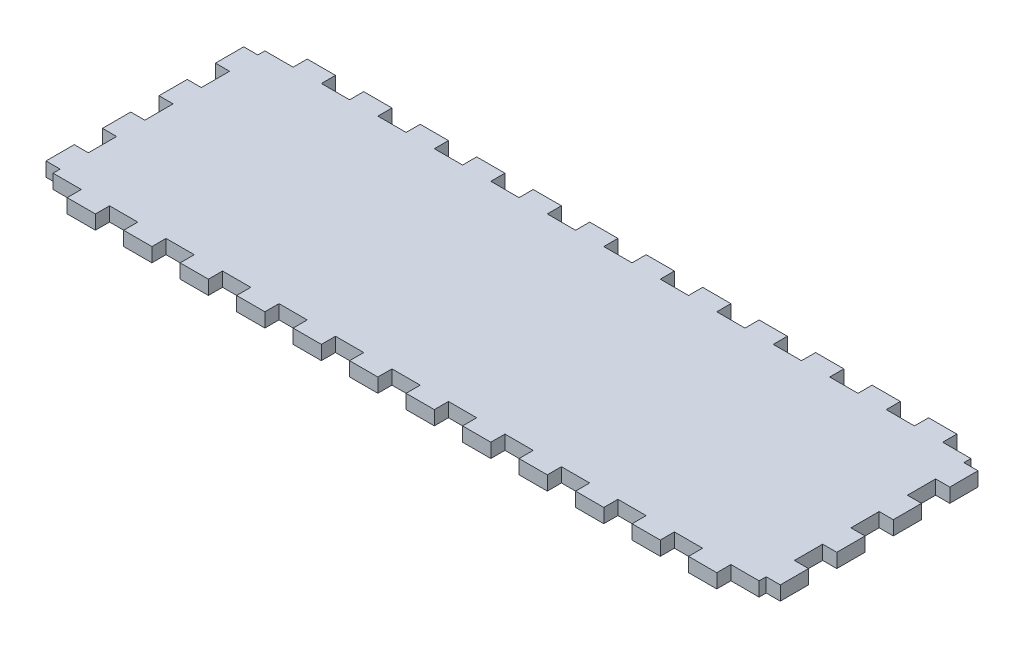
from build123d import *

# Parameters (mm, degrees)
SKETCH1_W                = 150
SKETCH1_H                = 45
BOSS_EXTRUDE1_DEPTH      = 3
SKETCH2_W                = 6
SKETCH2_H                = 3
BOSS_EXTRUDE2_DEPTH      = 3
LPATTERN1_COUNT          = 6
LPATTERN1_PITCH          = 12
LPATTERN1_COL_COUNT      = 7
LPATTERN1_COL_PITCH      = 12
SKETCH3_W                = 6
SKETCH3_H                = 3
BOSS_EXTRUDE3_DEPTH      = 3
LPATTERN2_COUNT          = 2
LPATTERN2_PITCH          = 12
LPATTERN2_COUNT_DIR2     = 3
LPATTERN2_PITCH_DIR2     = 12
MIRROR1_COPY_1_SKETCH_W  = 6
MIRROR1_COPY_1_SKETCH_H  = 3
MIRROR1_COPY_1_DEPTH     = 3
MIRROR1_COPY_2_SKETCH_W  = 6
MIRROR1_COPY_2_SKETCH_H  = 3
MIRROR1_COPY_2_DEPTH     = 3
MIRROR1_COPY_3_SKETCH_W  = 6
MIRROR1_COPY_3_SKETCH_H  = 3
MIRROR1_COPY_3_DEPTH     = 3
MIRROR1_COPY_4_SKETCH_W  = 6
MIRROR1_COPY_4_SKETCH_H  = 3
MIRROR1_COPY_4_DEPTH     = 3
MIRROR1_COPY_5_SKETCH_W  = 6
MIRROR1_COPY_5_SKETCH_H  = 3
MIRROR1_COPY_5_DEPTH     = 3
MIRROR1_COPY_6_SKETCH_W  = 6
MIRROR1_COPY_6_SKETCH_H  = 3
MIRROR1_COPY_6_DEPTH     = 3
MIRROR1_COPY_7_SKETCH_W  = 6
MIRROR1_COPY_7_SKETCH_H  = 3
MIRROR1_COPY_7_DEPTH     = 3
MIRROR1_COPY_8_SKETCH_W  = 6
MIRROR1_COPY_8_SKETCH_H  = 3
MIRROR1_COPY_8_DEPTH     = 3
MIRROR1_COPY_9_SKETCH_W  = 6
MIRROR1_COPY_9_SKETCH_H  = 3
MIRROR1_COPY_9_DEPTH     = 3
MIRROR1_COPY_10_SKETCH_W = 6
MIRROR1_COPY_10_SKETCH_H = 3
MIRROR1_COPY_10_DEPTH    = 3
MIRROR1_COPY_11_SKETCH_W = 6
MIRROR1_COPY_11_SKETCH_H = 3
MIRROR1_COPY_11_DEPTH    = 3
MIRROR1_COPY_12_SKETCH_W = 6
MIRROR1_COPY_12_SKETCH_H = 3
MIRROR1_COPY_12_DEPTH    = 3
MIRROR2_COPY_1_SKETCH_W  = 6
MIRROR2_COPY_1_SKETCH_H  = 3
MIRROR2_COPY_1_DEPTH     = 3
MIRROR2_COPY_2_SKETCH_W  = 6
MIRROR2_COPY_2_SKETCH_H  = 3
MIRROR2_COPY_2_DEPTH     = 3
MIRROR2_COPY_3_SKETCH_W  = 6
MIRROR2_COPY_3_SKETCH_H  = 3
MIRROR2_COPY_3_DEPTH     = 3
MIRROR2_COPY_4_SKETCH_W  = 6
MIRROR2_COPY_4_SKETCH_H  = 3
MIRROR2_COPY_4_DEPTH     = 3
MIRROR2_COPY_5_SKETCH_W  = 6
MIRROR2_COPY_5_SKETCH_H  = 3
MIRROR2_COPY_5_DEPTH     = 3
MIRROR2_COPY_6_SKETCH_W  = 6
MIRROR2_COPY_6_SKETCH_H  = 3
MIRROR2_COPY_6_DEPTH     = 3


with BuildPart() as part:
    # Sketch1 → Boss-Extrude1 (new body)
    with BuildSketch(Plane(origin=(0, 0, 0), x_dir=(1, 0, 0), z_dir=(0, 1, 0))):
        Rectangle(SKETCH1_W, SKETCH1_H)
    extrude(amount=BOSS_EXTRUDE1_DEPTH)

    # Sketch2 → Boss-Extrude2 (add)
    with BuildSketch(Plane.XY.offset(22.5)):
        with Locations((6, 1.5)):
            Rectangle(SKETCH2_W, SKETCH2_H)
    boss_extrude2 = extrude(amount=BOSS_EXTRUDE2_DEPTH)

    # LPattern1: Boss-Extrude2 ×6
    with Locations(*[(i * LPATTERN1_PITCH, 0, 0) for i in range(1, LPATTERN1_COUNT)]):
        add(boss_extrude2)

    # LPattern1 col: Boss-Extrude2 ×7
    with Locations(*[(-i * LPATTERN1_COL_PITCH, 0, 0) for i in range(1, LPATTERN1_COL_COUNT)]):
        add(boss_extrude2)

    # Sketch3 → Boss-Extrude3 (add)
    with BuildSketch(Plane(origin=(75, 0, 0), x_dir=(0, 0, -1), z_dir=(1, 0, 0))):
        with Locations((6, 1.5)):
            Rectangle(SKETCH3_W, SKETCH3_H)
    boss_extrude3 = extrude(amount=BOSS_EXTRUDE3_DEPTH)

    # LPattern2: Boss-Extrude3 2 × 3
    with Locations(*[Vector(0, 0, -1) * (i * LPATTERN2_PITCH) + Vector(0, 0, 1) * (j * LPATTERN2_PITCH_DIR2) for i in range(LPATTERN2_COUNT) for j in range(LPATTERN2_COUNT_DIR2) if (i, j) != (0, 0)]):
        add(boss_extrude3)

    # Mirror1 copy 1 sketch → Mirror1 copy 1 (add)
    with BuildSketch(Plane(origin=(12, 0, -22.5), x_dir=(1, 0, 0), z_dir=(0, 0, -1))):
        with Locations((6, -1.5)):
            Rectangle(MIRROR1_COPY_1_SKETCH_W, MIRROR1_COPY_1_SKETCH_H)
    extrude(amount=MIRROR1_COPY_1_DEPTH)

    # Mirror1 copy 2 sketch → Mirror1 copy 2 (add)
    with BuildSketch(Plane(origin=(24, 0, -22.5), x_dir=(1, 0, 0), z_dir=(0, 0, -1))):
        with Locations((6, -1.5)):
            Rectangle(MIRROR1_COPY_2_SKETCH_W, MIRROR1_COPY_2_SKETCH_H)
    extrude(amount=MIRROR1_COPY_2_DEPTH)

    # Mirror1 copy 3 sketch → Mirror1 copy 3 (add)
    with BuildSketch(Plane(origin=(36, 0, -22.5), x_dir=(1, 0, 0), z_dir=(0, 0, -1))):
        with Locations((6, -1.5)):
            Rectangle(MIRROR1_COPY_3_SKETCH_W, MIRROR1_COPY_3_SKETCH_H)
    extrude(amount=MIRROR1_COPY_3_DEPTH)

    # Mirror1 copy 4 sketch → Mirror1 copy 4 (add)
    with BuildSketch(Plane(origin=(48, 0, -22.5), x_dir=(1, 0, 0), z_dir=(0, 0, -1))):
        with Locations((6, -1.5)):
            Rectangle(MIRROR1_COPY_4_SKETCH_W, MIRROR1_COPY_4_SKETCH_H)
    extrude(amount=MIRROR1_COPY_4_DEPTH)

    # Mirror1 copy 5 sketch → Mirror1 copy 5 (add)
    with BuildSketch(Plane(origin=(60, 0, -22.5), x_dir=(1, 0, 0), z_dir=(0, 0, -1))):
        with Locations((6, -1.5)):
            Rectangle(MIRROR1_COPY_5_SKETCH_W, MIRROR1_COPY_5_SKETCH_H)
    extrude(amount=MIRROR1_COPY_5_DEPTH)

    # Mirror1 copy 6 sketch → Mirror1 copy 6 (add)
    with BuildSketch(Plane(origin=(-12, 0, -22.5), x_dir=(1, 0, 0), z_dir=(0, 0, -1))):
        with Locations((6, -1.5)):
            Rectangle(MIRROR1_COPY_6_SKETCH_W, MIRROR1_COPY_6_SKETCH_H)
    extrude(amount=MIRROR1_COPY_6_DEPTH)

    # Mirror1 copy 7 sketch → Mirror1 copy 7 (add)
    with BuildSketch(Plane(origin=(-24, 0, -22.5), x_dir=(1, 0, 0), z_dir=(0, 0, -1))):
        with Locations((6, -1.5)):
            Rectangle(MIRROR1_COPY_7_SKETCH_W, MIRROR1_COPY_7_SKETCH_H)
    extrude(amount=MIRROR1_COPY_7_DEPTH)

    # Mirror1 copy 8 sketch → Mirror1 copy 8 (add)
    with BuildSketch(Plane(origin=(-36, 0, -22.5), x_dir=(1, 0, 0), z_dir=(0, 0, -1))):
        with Locations((6, -1.5)):
            Rectangle(MIRROR1_COPY_8_SKETCH_W, MIRROR1_COPY_8_SKETCH_H)
    extrude(amount=MIRROR1_COPY_8_DEPTH)

    # Mirror1 copy 9 sketch → Mirror1 copy 9 (add)
    with BuildSketch(Plane(origin=(-48, 0, -22.5), x_dir=(1, 0, 0), z_dir=(0, 0, -1))):
        with Locations((6, -1.5)):
            Rectangle(MIRROR1_COPY_9_SKETCH_W, MIRROR1_COPY_9_SKETCH_H)
    extrude(amount=MIRROR1_COPY_9_DEPTH)

    # Mirror1 copy 10 sketch → Mirror1 copy 10 (add)
    with BuildSketch(Plane(origin=(-60, 0, -22.5), x_dir=(1, 0, 0), z_dir=(0, 0, -1))):
        with Locations((6, -1.5)):
            Rectangle(MIRROR1_COPY_10_SKETCH_W, MIRROR1_COPY_10_SKETCH_H)
    extrude(amount=MIRROR1_COPY_10_DEPTH)

    # Mirror1 copy 11 sketch → Mirror1 copy 11 (add)
    with BuildSketch(Plane(origin=(-72, 0, -22.5), x_dir=(1, 0, 0), z_dir=(0, 0, -1))):
        with Locations((6, -1.5)):
            Rectangle(MIRROR1_COPY_11_SKETCH_W, MIRROR1_COPY_11_SKETCH_H)
    extrude(amount=MIRROR1_COPY_11_DEPTH)

    # Mirror1 copy 12 sketch → Mirror1 copy 12 (add)
    with BuildSketch(Plane(origin=(0, 0, -22.5), x_dir=(1, 0, 0), z_dir=(0, 0, -1))):
        with Locations((6, -1.5)):
            Rectangle(MIRROR1_COPY_12_SKETCH_W, MIRROR1_COPY_12_SKETCH_H)
    extrude(amount=MIRROR1_COPY_12_DEPTH)

    # Mirror2 copy 1 sketch → Mirror2 copy 1 (add)
    with BuildSketch(Plane(origin=(-75, 0, 12), x_dir=(0, 0, -1), z_dir=(-1, 0, 0))):
        with Locations((6, -1.5)):
            Rectangle(MIRROR2_COPY_1_SKETCH_W, MIRROR2_COPY_1_SKETCH_H)
    extrude(amount=MIRROR2_COPY_1_DEPTH)

    # Mirror2 copy 2 sketch → Mirror2 copy 2 (add)
    with BuildSketch(Plane(origin=(-75, 0, 24), x_dir=(0, 0, -1), z_dir=(-1, 0, 0))):
        with Locations((6, -1.5)):
            Rectangle(MIRROR2_COPY_2_SKETCH_W, MIRROR2_COPY_2_SKETCH_H)
    extrude(amount=MIRROR2_COPY_2_DEPTH)

    # Mirror2 copy 3 sketch → Mirror2 copy 3 (add)
    with BuildSketch(Plane(origin=(-75, 0, -12), x_dir=(0, 0, -1), z_dir=(-1, 0, 0))):
        with Locations((6, -1.5)):
            Rectangle(MIRROR2_COPY_3_SKETCH_W, MIRROR2_COPY_3_SKETCH_H)
    extrude(amount=MIRROR2_COPY_3_DEPTH)

    # Mirror2 copy 4 sketch → Mirror2 copy 4 (add)
    with BuildSketch(Plane(origin=(-75, 0, 0), x_dir=(0, 0, -1), z_dir=(-1, 0, 0))):
        with Locations((6, -1.5)):
            Rectangle(MIRROR2_COPY_4_SKETCH_W, MIRROR2_COPY_4_SKETCH_H)
    extrude(amount=MIRROR2_COPY_4_DEPTH)

    # Mirror2 copy 5 sketch → Mirror2 copy 5 (add)
    with BuildSketch(Plane(origin=(-75, 0, 12), x_dir=(0, 0, -1), z_dir=(-1, 0, 0))):
        with Locations((6, -1.5)):
            Rectangle(MIRROR2_COPY_5_SKETCH_W, MIRROR2_COPY_5_SKETCH_H)
    extrude(amount=MIRROR2_COPY_5_DEPTH)

    # Mirror2 copy 6 sketch → Mirror2 copy 6 (add)
    with BuildSketch(Plane(origin=(-75, 0, 0), x_dir=(0, 0, -1), z_dir=(-1, 0, 0))):
        with Locations((6, -1.5)):
            Rectangle(MIRROR2_COPY_6_SKETCH_W, MIRROR2_COPY_6_SKETCH_H)
    extrude(amount=MIRROR2_COPY_6_DEPTH)


solid = part.part
